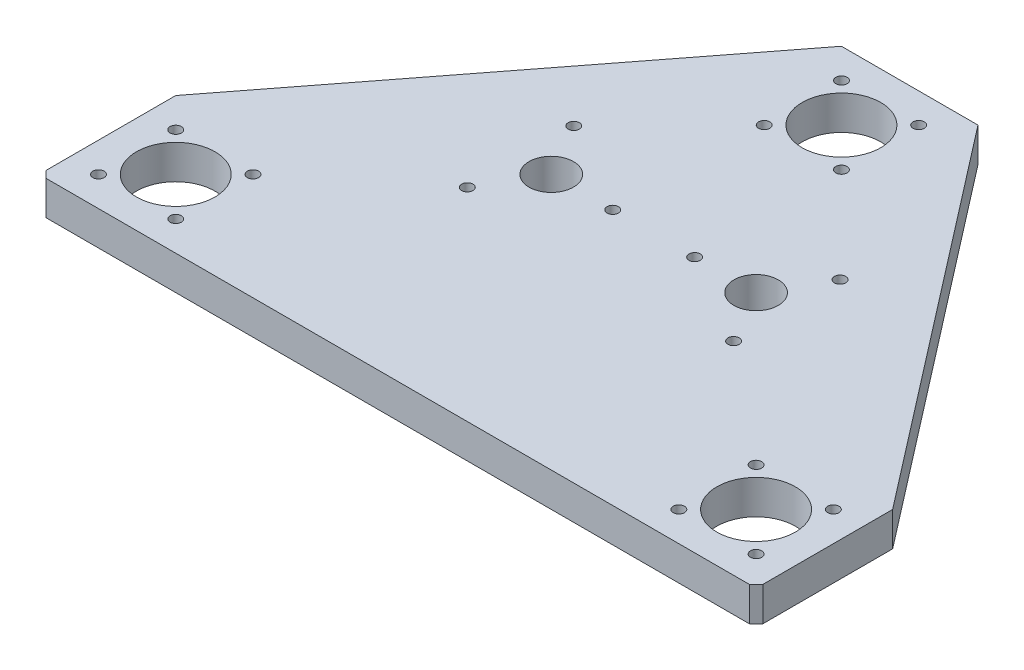
from build123d import *

# Parameters (mm, degrees)
SKETCH1_R             = 6.5
SKETCH1_R_2           = 11.5
BOSS_EXTRUDE1_DEPTH   = 10
CHAMFER1_SIZE         = 2
M4X0_7_TAPPED_HOLE1_D = 3.3
M4X0_7_TAPPED_HOLE2_D = 3.3
CIRPATTERN1_COUNT     = 3
MIRROR1_COPY_1_D      = 3.3
MIRROR1_COPY_2_D      = 3.3


with BuildPart() as part:
    # Sketch1 → Boss-Extrude1 (new body)
    with BuildSketch(Plane(origin=(0, 0, 0), x_dir=(1, 0, 0), z_dir=(0, 1, 0))):
        Polygon((-105, -35), (-20, 75), (20, 75), (105, -35), (105, -75), (65, -75), (-65, -75), (-105, -75), align=None)
        with Locations((-30, 0)):
            Circle(SKETCH1_R, mode=Mode.SUBTRACT)
        with Locations((30, 0)):
            Circle(SKETCH1_R, mode=Mode.SUBTRACT)
        with Locations((0, 55)):
            Circle(SKETCH1_R_2, mode=Mode.SUBTRACT)
        with Locations((85, -55)):
            Circle(SKETCH1_R_2, mode=Mode.SUBTRACT)
        with Locations((-85, -55)):
            Circle(SKETCH1_R_2, mode=Mode.SUBTRACT)
    extrude(amount=BOSS_EXTRUDE1_DEPTH)

    # Chamfer1
    chamfer1_edges = [part.edges().sort_by_distance(p)[0] for p in [
        (105, 5, 75),
        (-105, 5, 75),
    ]]
    chamfer(chamfer1_edges, length=CHAMFER1_SIZE)

    # M4x0.7 Tapped Hole1 (through all)
    with Locations(Plane(origin=(-96.313708499, 10, 43.686291501), x_dir=(0, 0, 1), z_dir=(0, 1, 0))):
        with Locations((0, 0), (0, 22.627416998), (22.627416998, 22.627416998), (22.627416998, 0), (-87.372583002, 85), (-110, 85)):
            m4x0_7_tapped_hole1 = Hole(M4X0_7_TAPPED_HOLE1_D / 2)

    # M4x0.7 Tapped Hole2 (through all)
    with Locations(Plane(origin=(-12, 10, 0), x_dir=(0, 0, 1), z_dir=(0, 1, 0))):
        with Locations((0, 0)):
            m4x0_7_tapped_hole2 = Hole(M4X0_7_TAPPED_HOLE2_D / 2)

    # CirPattern1: M4x0.7 Tapped Hole2 ×3 about axis
    cirpattern1_axis = Axis((-30, 10, 0), (0, -1, 0))
    for i in range(1, CIRPATTERN1_COUNT):
        add(m4x0_7_tapped_hole2.rotate(cirpattern1_axis, i * 360 / CIRPATTERN1_COUNT), mode=Mode.SUBTRACT)

    # Mirror1: M4x0.7 Tapped Hole1, M4x0.7 Tapped Hole2 across plane
    add(m4x0_7_tapped_hole1.mirror(Plane(origin=(0, 0, 0), x_dir=(0, 0, 1), z_dir=(1, 0, 0))), mode=Mode.SUBTRACT)
    add(m4x0_7_tapped_hole2.mirror(Plane(origin=(0, 0, 0), x_dir=(0, 0, 1), z_dir=(1, 0, 0))), mode=Mode.SUBTRACT)

    # Mirror1 copy 1 (through all)
    with Locations(Plane(origin=(39, 10, 15.588457268), x_dir=(0.8660254037844387, 0, -0.4999999999999998), z_dir=(0, 1, 0))):
        with Locations((0, 0)):
            Hole(MIRROR1_COPY_1_D / 2)

    # Mirror1 copy 2 (through all)
    with Locations(Plane(origin=(39, 10, -15.588457268), x_dir=(-0.8660254037844384, 0, -0.5000000000000004), z_dir=(0, 1, 0))):
        with Locations((0, 0)):
            Hole(MIRROR1_COPY_2_D / 2)


solid = part.part
